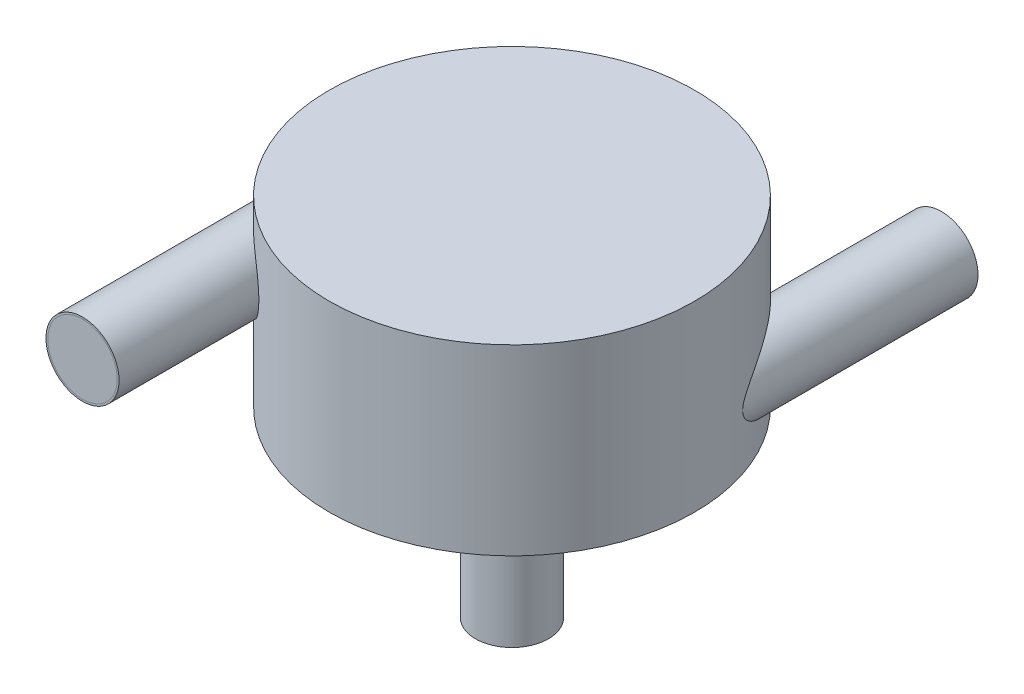
from build123d import *

# Parameters (mm, degrees)
SKETCH1_R            = 1000
BOSS_EXTRUDE1_DEPTH  = 1000
SKETCH3_R            = 200
OUTLET_EXTRUDE_DEPTH = 1000
INLET_1_REACH        = 2961.73
INLET_1_END_RADIUS   = 1000
SKETCH2_R            = 200
SKETCH4_R            = 200
INLET_2_DEPTH        = 1287.750099
SHELL1_T             = -10
SKETCH5_R            = 190
LID_1_DEPTH          = 50
SKETCH6_R            = 190
LID_2_DEPTH          = 50
SKETCH7_R            = 190
LID_3_DEPTH          = 50


with BuildPart() as part:
    # Sketch1 → Boss-Extrude1 (new body)
    with BuildSketch(Plane(origin=(0, 0, 0), x_dir=(1, 0, 0), z_dir=(0, 1, 0))):
        with Locations(Location((0, 0, 0), (0, 0, 270))):
            Circle(SKETCH1_R)
    extrude(amount=BOSS_EXTRUDE1_DEPTH)

    # Sketch3 → Outlet Extrude (add)
    with BuildSketch(Plane.XZ):
        with Locations(Location((0, 0, 0), (0, 0, 270))):
            Circle(SKETCH3_R)
    extrude(amount=OUTLET_EXTRUDE_DEPTH)

    # Inlet 1: up to this cylinder (the profile starts outside it)
    inlet_1_end = Plane(origin=(0, 650, 0), z_dir=(0, -1, 0)) * Cylinder(INLET_1_END_RADIUS, 7924.46, mode=Mode.PRIVATE)
    # Sketch2 → Inlet 1 (add, up to the surface)
    with BuildSketch(Plane.XY.offset(1600), mode=Mode.PRIVATE) as inlet_1_sk1:
        with Locations((-750, 650)):
            Circle(SKETCH2_R)
    inlet_1_tool1 = extrude(inlet_1_sk1.sketch, amount=-INLET_1_REACH, mode=Mode.PRIVATE) - inlet_1_end
    add(inlet_1_tool1.solids().sort_by_distance((-750, 650, 1600))[0])


with BuildPart() as inlet_2_tool:
    # Sketch4 → Inlet 2 (new body)
    with BuildSketch(Plane.XY.offset(-1600)):
        with Locations(Location((750, 300, 0), (0, 0, 180))):
            Circle(SKETCH4_R)
    extrude(amount=INLET_2_DEPTH)


with BuildPart() as part_1:
    add(part.part)


with BuildPart() as part_2:
    # Inlet 2: joined with inlet_2_tool
    add(part_1.part.fuse(inlet_2_tool.part, tol=0.00001))

    # Shell1
    shell1_openings = [part_2.faces().sort_by_distance(p)[0] for p in [
        (-750, 650, 1600),
        (750, 300, -1600),
        (0, -1000, 0),
    ]]
    offset(amount=SHELL1_T, openings=shell1_openings, kind=Kind.INTERSECTION)


with BuildPart() as body_2:
    # Sketch5 → Lid 1 (new body)
    with BuildSketch(Plane.XY.offset(1600)):
        with Locations((-750, 650)):
            Circle(SKETCH5_R)
    extrude(amount=-LID_1_DEPTH)


with BuildPart() as body_3:
    # Sketch6 → Lid 2 (new body)
    with BuildSketch(Plane(origin=(0, 0, -1600), x_dir=(-1, 0, 0), z_dir=(0, 0, -1))):
        with Locations((-750, 300)):
            Circle(SKETCH6_R)
    extrude(amount=-LID_2_DEPTH)


with BuildPart() as body_4:
    # Sketch7 → Lid 3 (new body)
    with BuildSketch(Plane.XZ.offset(1000)):
        with Locations(Location((0, 0, 0), (0, 0, 270))):
            Circle(SKETCH7_R)
    extrude(amount=-LID_3_DEPTH)


solid = Compound([part_2.part, body_2.part, body_3.part, body_4.part])
